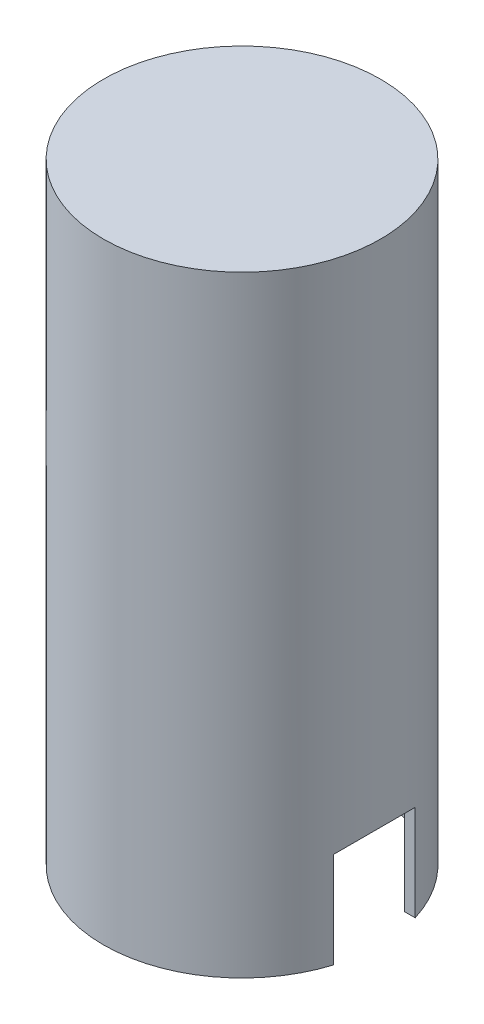
from build123d import *

# Parameters (mm, degrees)
SKETCH3_R               = 68
BOSS_EXTRUDE1_DEPTH     = 300
SHELL1_T                = -5
CUT_EXTRUDE3_DEPTH      = 20
CUT_EXTRUDE3_DEPTH_BACK = 20


with BuildPart() as part:
    # Sketch3 → Boss-Extrude1 (new body)
    with BuildSketch(Plane(origin=(0, 0, 0), x_dir=(1, 0, 0), z_dir=(0, 1, 0))):
        Circle(SKETCH3_R)
    extrude(amount=BOSS_EXTRUDE1_DEPTH)

    # Shell1
    shell1_openings = [part.faces().sort_by_distance(p)[0] for p in [
        (0, 0, 0),
    ]]
    offset(amount=SHELL1_T, openings=shell1_openings, kind=Kind.INTERSECTION)

    # Sketch8 → Cut-Extrude3 (cut, two sides: drawn at the far end of the back side and taken through both)
    with BuildSketch(Plane.XY.offset(-CUT_EXTRUDE3_DEPTH_BACK)):
        Polygon((-68, 0), (-58, 0), (-58, 40), (-68, 50), align=None)
        Polygon((68, 0), (58, 0), (58, 40), (68, 50), align=None)
    extrude(amount=CUT_EXTRUDE3_DEPTH + CUT_EXTRUDE3_DEPTH_BACK, mode=Mode.SUBTRACT)


solid = part.part
